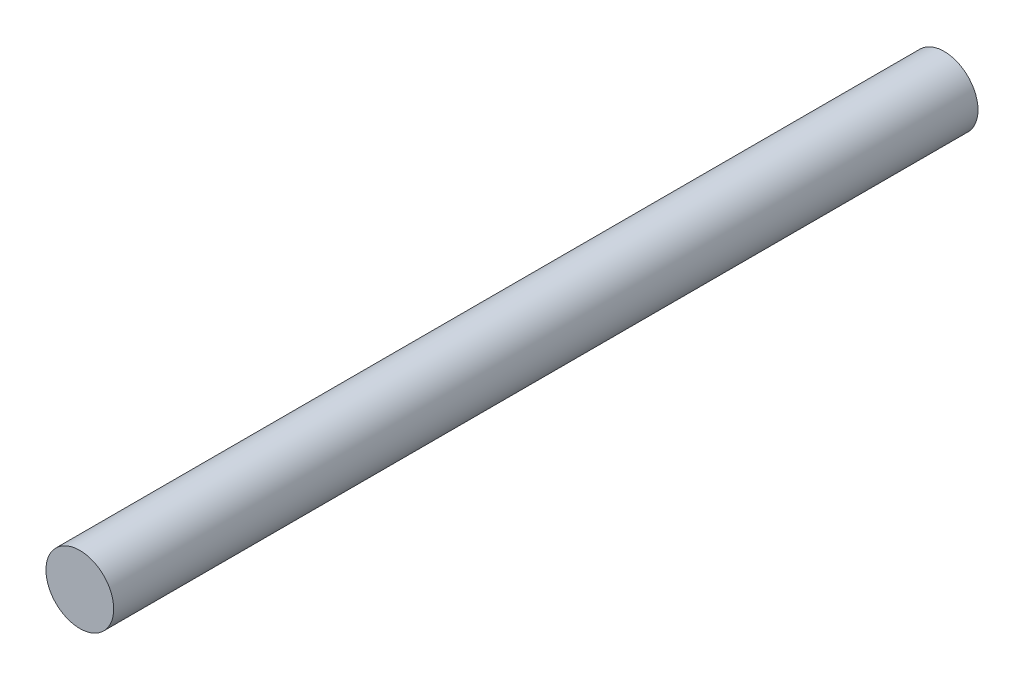
from build123d import *

# Parameters (mm, degrees)
CROQUIS1_R              = 3.175
SALIENTE_EXTRUIR1_DEPTH = 40.5


with BuildPart() as part:
    # Croquis1 → Saliente-Extruir1 (new, symmetric)
    with BuildSketch(Plane.XY):
        Circle(CROQUIS1_R)
    extrude(amount=SALIENTE_EXTRUIR1_DEPTH, both=True)


solid = part.part
